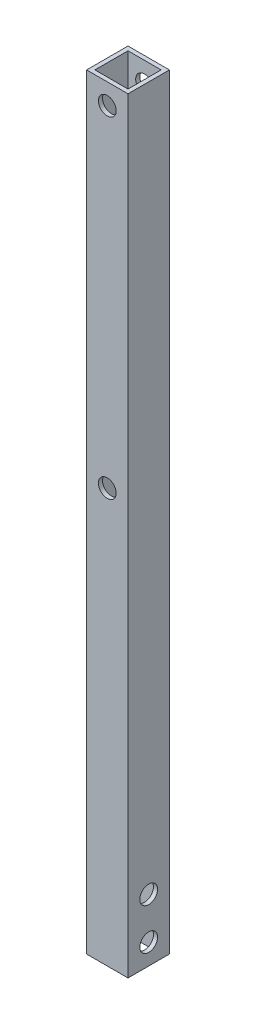
from build123d import *

# Parameters (mm, degrees)
SKETCH_1_W          = 10
SKETCH_1_H          = 10
SKETCH_1_W_2        = 8
SKETCH_1_H_2        = 8
EXTRUDE_1_DEPTH     = 185
SKETCH_2_R          = 2.15
CUT_EXTRUDE_1_DEPTH = 186.337529929
SKETCH_3_R          = 2.15
CUT_EXTRUDE_2_DEPTH = 186.337529929


with BuildPart() as part:
    # ｽｹｯﾁ1 → 押し出し-薄板1 (new body)
    with BuildSketch(Plane(origin=(0, 0, 0), x_dir=(1, 0, 0), z_dir=(0, 1, 0))):
        Rectangle(SKETCH_1_W, SKETCH_1_H)
        Rectangle(SKETCH_1_W_2, SKETCH_1_H_2, mode=Mode.SUBTRACT)
    extrude(amount=EXTRUDE_1_DEPTH)

    # ｽｹｯﾁ2 → ｶｯﾄ - 押し出し1 (cut, through all)
    with BuildSketch(Plane(origin=(5, 0, 0), x_dir=(0, 0, -1), z_dir=(1, 0, 0))):
        with Locations((0, 5)):
            Circle(SKETCH_2_R)
        with Locations((0, 15)):
            Circle(SKETCH_2_R)
    extrude(amount=-CUT_EXTRUDE_1_DEPTH, mode=Mode.SUBTRACT)

    # ｽｹｯﾁ3 → ｶｯﾄ - 押し出し2 (cut, through all)
    with BuildSketch(Plane.XY.offset(5)):
        with Locations((0, 180)):
            Circle(SKETCH_3_R)
        with Locations((0, 100)):
            Circle(SKETCH_3_R)
    extrude(amount=-CUT_EXTRUDE_2_DEPTH, mode=Mode.SUBTRACT)


solid = part.part
